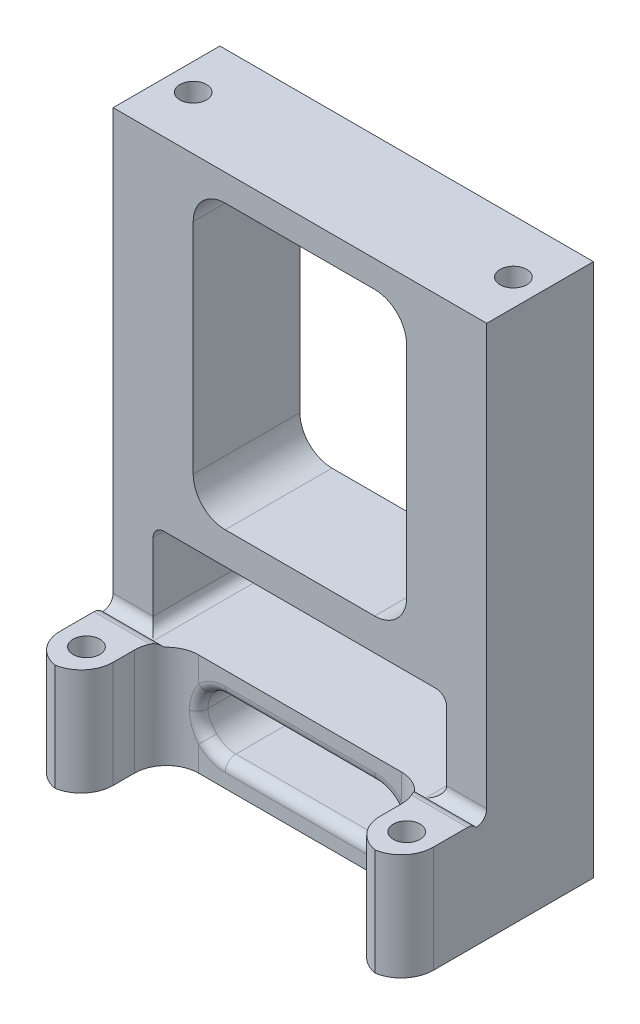
from build123d import *

# Parameters (mm, degrees)
SKETCH_1_W             = 35
SKETCH_1_H             = 50
SKETCH_1_W_2           = 16
SKETCH_1_H_2           = 8.4
EXTRUDE_564_DEPTH      = 5
SKETCH_2_W             = 5.75
SKETCH_2_H             = 8.4
CUT_EXTRUDE_879_DEPTH  = 8.5
FILLET_1_R             = 1
SKETCH_3_R             = 1.25
CUT_EXTRUDE_1403_DEPTH = 8
SKETCH_10_R            = 1.25
CUT_EXTRUDE_1593_DEPTH = 10
SKETCH_11_W            = 20
SKETCH_11_H            = 26.5
CUT_EXTRUDE_1977_DEPTH = 42.432957896
FILLET_2_R             = 3
SKETCH_13_W            = 5
SKETCH_13_H            = 8
EXTRUDE_4716_DEPTH     = 9.6
SKETCH_16_W            = 5
SKETCH_16_H            = 7
EXTRUDE_5207_DEPTH     = 0.4
SKETCH_14_R            = 1.25
CUT_EXTRUDE_5724_DEPTH = 46.55491192
FILLET_3_R             = 3
FILLET_4_R             = 1
FILLET_5_R             = 1
CUT_EXTRUDE_6952_REACH = 43.433
SKETCH_17_W            = 19
SKETCH_17_H            = 5
FILLET_6_R             = 2.5
FILLET_7_R             = 1


# Some blends are built 0.0001 mm under size
with BuildPart() as part:
    # Эскиз1 → Extrude 564 (new, symmetric)
    with BuildSketch(Plane.XY):
        with Locations((0, 11.2)):
            Rectangle(SKETCH_1_W, SKETCH_1_H)
        Rectangle(SKETCH_1_W_2, SKETCH_1_H_2, mode=Mode.SUBTRACT)
    extrude(amount=EXTRUDE_564_DEPTH, both=True)

    # Эскиз2 → Cut-Extrude 879 (cut)
    with BuildSketch(Plane.XY.offset(5)):
        with Locations((-10.875, 0)):
            Rectangle(SKETCH_2_W, SKETCH_2_H)
        with Locations((10.875, 0)):
            Rectangle(SKETCH_2_W, SKETCH_2_H)
    extrude(amount=-CUT_EXTRUDE_879_DEPTH, mode=Mode.SUBTRACT)

    # Скругление1
    fillet_1_edges = [part.edges().sort_by_distance(p)[0] for p in [
        (-13.75, -4.2, 0.75),
        (-13.75, 4.2, 0.75),
        (13.75, 4.2, 0.75),
        (13.75, -4.2, 0.75),
    ]]
    fillet(fillet_1_edges, radius=FILLET_1_R)

    # Эскиз3 → Cut-Extrude 1403 (cut)
    with BuildSketch(Plane.XY.offset(-3.5)):
        with Locations((-10.3, 0)):
            Circle(SKETCH_3_R)
        with Locations((10.3, 0)):
            Circle(SKETCH_3_R)
    extrude(amount=-CUT_EXTRUDE_1403_DEPTH, mode=Mode.SUBTRACT)

    # Эскиз10 → Cut-Extrude 1593 (cut)
    with BuildSketch(Plane.XZ.offset(13.8)):
        with Locations(Location((-15, 0, 0), (0, 0, 270))):
            Circle(SKETCH_10_R)
        with Locations(Location((15, 0, 0), (0, 0, 270))):
            Circle(SKETCH_10_R)
    cut_extrude_1593 = extrude(amount=-CUT_EXTRUDE_1593_DEPTH, mode=Mode.SUBTRACT)

    # Mirror 1655: Cut-Extrude 1593 across plane
    add(cut_extrude_1593.mirror(Plane.ZX.offset(11.2)), mode=Mode.SUBTRACT)

    # Эскиз11 → Cut-Extrude 1977 (cut, through all)
    with BuildSketch(Plane.XY.offset(5)):
        with Locations((0, 20.45)):
            Rectangle(SKETCH_11_W, SKETCH_11_H)
    extrude(amount=-CUT_EXTRUDE_1977_DEPTH, mode=Mode.SUBTRACT)

    # Скругление2
    fillet_2_edges = [part.edges().sort_by_distance(p)[0] for p in [
        (10, 7.2, 0),
        (-10, 7.2, 0),
        (-10, 33.7, 0),
        (10, 33.7, 0),
    ]]
    fillet(fillet_2_edges, radius=FILLET_2_R)

    # Эскиз13 → Extrude 4716 (add)
    with BuildSketch(Plane.XZ.offset(13.8)):
        with Locations((-15, 9)):
            Rectangle(SKETCH_13_W, SKETCH_13_H)
        with Locations((15, 9)):
            Rectangle(SKETCH_13_W, SKETCH_13_H)
    extrude(amount=-EXTRUDE_4716_DEPTH)

    # Эскиз16 → Extrude 5207 (add)
    with BuildSketch(Plane(origin=(0, -4.2, 0), x_dir=(1, 0, 0), z_dir=(0, 1, 0))):
        with Locations((-15, -9.5)):
            Rectangle(SKETCH_16_W, SKETCH_16_H)
        with Locations((15, -9.5)):
            Rectangle(SKETCH_16_W, SKETCH_16_H)
    extrude(amount=EXTRUDE_5207_DEPTH)

    # Эскиз14 → Cut-Extrude 5724 (cut, through all)
    with BuildSketch(Plane(origin=(0, -3.8, 0), x_dir=(1, 0, 0), z_dir=(0, 1, 0))):
        with Locations(Location((-15, -10, 0), (0, 0, 270))):
            Circle(SKETCH_14_R)
        with Locations(Location((15, -10, 0), (0, 0, 90))):
            Circle(SKETCH_14_R)
    extrude(amount=-CUT_EXTRUDE_5724_DEPTH, mode=Mode.SUBTRACT)

    # Скругление3
    # the kernel refuses this fillet: 3 mm, written as the material it adds along each edge
    with BuildSketch(Plane(origin=(12.5, -13.8, 5), x_dir=(-1, 0, 0), z_dir=(0, 1, 0))) as fillet_3_piece_1_section:
        with BuildLine():
            CenterArc((FILLET_3_R, FILLET_3_R), FILLET_3_R, 180, 90)
            Line((0, FILLET_3_R), (0, 0))
            Line((0, 0), (FILLET_3_R, 0))
        make_face()
    fillet_3_piece_1 = extrude(amount=9.6, mode=Mode.PRIVATE)
    fillet_3_piece_1 = split(fillet_3_piece_1, bisect_by=Plane(origin=(11.641402177, -9, 6), z_dir=(0, 0, -1)), keep=Keep.TOP, mode=Mode.PRIVATE)
    add(fillet_3_piece_1)
    with BuildSketch(Plane(origin=(12.5, -13.8, 5), x_dir=(-1, 0, 0), z_dir=(0, 1, 0))) as fillet_3_piece_2_section:
        with BuildLine():
            CenterArc((FILLET_3_R, FILLET_3_R), FILLET_3_R, 180, 90)
            Line((0, FILLET_3_R), (0, 0))
            Line((0, 0), (FILLET_3_R, 0))
        make_face()
    fillet_3_piece_2 = extrude(amount=9.6, mode=Mode.PRIVATE)
    fillet_3_piece_2 = split(fillet_3_piece_2, bisect_by=Plane(origin=(12.327479681, -9, 6), z_dir=(0, 0, 1)), keep=Keep.TOP, mode=Mode.PRIVATE)
    add(fillet_3_piece_2)
    with BuildSketch(Plane(origin=(12.5, -13.8, 5), x_dir=(-1, 0, 0), z_dir=(0, 1, 0))) as fillet_3_piece_3_section:
        with BuildLine():
            CenterArc((FILLET_3_R, FILLET_3_R), FILLET_3_R, 180, 90)
            Line((0, FILLET_3_R), (0, 0))
            Line((0, 0), (FILLET_3_R, 0))
        make_face()
    fillet_3_piece_3 = extrude(amount=17.1, mode=Mode.PRIVATE)
    fillet_3_piece_3 = split(fillet_3_piece_3, bisect_by=Plane(origin=(12.327479681, -4.2, 6.589070595), z_dir=(0, 1, 0)), keep=Keep.TOP, mode=Mode.PRIVATE)
    fillet_3_piece_3 = split(fillet_3_piece_3, bisect_by=Plane(origin=(12.327479681, -3.8, 6.589070595), z_dir=(0, -1, 0)), keep=Keep.TOP, mode=Mode.PRIVATE)
    fillet_3_piece_3 = split(fillet_3_piece_3, bisect_by=Plane(origin=(12.327479681, -4, 6), z_dir=(0, 0, 1)), keep=Keep.TOP, mode=Mode.PRIVATE)
    add(fillet_3_piece_3)
    with BuildSketch(Plane(origin=(-12.5, -13.8, 5), x_dir=(0, 0, 1), z_dir=(0, 1, 0))) as fillet_3_piece_4_section:
        with BuildLine():
            CenterArc((FILLET_3_R, FILLET_3_R), FILLET_3_R, 180, 90)
            Line((0, FILLET_3_R), (0, 0))
            Line((0, 0), (FILLET_3_R, 0))
        make_face()
    fillet_3_piece_4 = extrude(amount=9.6, mode=Mode.PRIVATE)
    fillet_3_piece_4 = split(fillet_3_piece_4, bisect_by=Plane(origin=(-12.327479681, -9, 6), z_dir=(0, 0, 1)), keep=Keep.TOP, mode=Mode.PRIVATE)
    add(fillet_3_piece_4)
    with BuildSketch(Plane(origin=(-12.5, -13.8, 5), x_dir=(0, 0, 1), z_dir=(0, 1, 0))) as fillet_3_piece_5_section:
        with BuildLine():
            CenterArc((FILLET_3_R, FILLET_3_R), FILLET_3_R, 180, 90)
            Line((0, FILLET_3_R), (0, 0))
            Line((0, 0), (FILLET_3_R, 0))
        make_face()
    fillet_3_piece_5 = extrude(amount=9.6, mode=Mode.PRIVATE)
    fillet_3_piece_5 = split(fillet_3_piece_5, bisect_by=Plane(origin=(-11.641402177, -9, 6), z_dir=(0, 0, -1)), keep=Keep.TOP, mode=Mode.PRIVATE)
    add(fillet_3_piece_5)
    with BuildSketch(Plane(origin=(-12.5, -13.8, 5), x_dir=(0, 0, 1), z_dir=(0, 1, 0))) as fillet_3_piece_6_section:
        with BuildLine():
            CenterArc((FILLET_3_R, FILLET_3_R), FILLET_3_R, 180, 90)
            Line((0, FILLET_3_R), (0, 0))
            Line((0, 0), (FILLET_3_R, 0))
        make_face()
    fillet_3_piece_6 = extrude(amount=17.1, mode=Mode.PRIVATE)
    fillet_3_piece_6 = split(fillet_3_piece_6, bisect_by=Plane(origin=(-12.327479681, -4.2, 6.589070595), z_dir=(0, 1, 0)), keep=Keep.TOP, mode=Mode.PRIVATE)
    fillet_3_piece_6 = split(fillet_3_piece_6, bisect_by=Plane(origin=(-12.327479681, -4, 6), z_dir=(0, 0, 1)), keep=Keep.TOP, mode=Mode.PRIVATE)
    fillet_3_piece_6 = split(fillet_3_piece_6, bisect_by=Plane(origin=(-12.327479681, -3.8, 6.589070595), z_dir=(0, -1, 0)), keep=Keep.TOP, mode=Mode.PRIVATE)
    add(fillet_3_piece_6)
    # the kernel refuses this fillet: 3 mm, written as the material it takes off along each edge
    with BuildSketch(Plane(origin=(17.5, 3.7, 13), x_dir=(-1, 0, 0), z_dir=(0, -1, 0)), Plane(origin=(12.5, -21.3, 13), x_dir=(1, 0, 0), z_dir=(0, 1, 0)), Plane(origin=(-17.5, -21.3, 13), x_dir=(1, 0, 0), z_dir=(0, 1, 0)), Plane(origin=(-12.5, -21.3, 13), x_dir=(0, 0, -1), z_dir=(0, 1, 0))) as fillet_3_2_piece_1:
        with BuildLine():
            CenterArc((FILLET_3_R, FILLET_3_R), FILLET_3_R, 180, 90)
            Line((0, FILLET_3_R), (0, 0))
            Line((0, 0), (FILLET_3_R, 0))
        make_face()
    extrude(amount=25, mode=Mode.SUBTRACT)

    # Скругление4
    fillet_4_edges = [part.edges().sort_by_distance(p)[0] for p in [
        (15.125, -4.2, 5),
        (-15.125, -4.2, 5),
    ]]
    fillet(fillet_4_edges, radius=FILLET_4_R - 0.0001)  # a hair under: the kernel refuses the full size

    # Скругление5
    # the kernel refuses this fillet: 1 mm, written as the material it takes off along each edge
    with BuildSketch(Plane(origin=(9.736067977, -3.8, 6), x_dir=(0, 0, 1), z_dir=(1, 0, 0))) as fillet_5_piece_1:
        with BuildLine():
            CenterArc((0.8, 1), FILLET_5_R, 216.869897646, 53.130102354)
            Line((0, 0.4), (-0.016, 0.388))
            ThreePointArc((-0.016, 0.388), (-0.02, 0.2), (-0.02, 0))
            Line((-0.02, 0), (0, -0.02))
            Line((0, -0.02), (0.8, -0.02))
            Line((0.8, -0.02), (0.8, 0))
        make_face()
    extrude(amount=9.763932023, mode=Mode.SUBTRACT)
    with BuildSketch(Plane(origin=(-9.736067977, -3.8, 6), x_dir=(0, -1, 0), z_dir=(-1, 0, 0))) as fillet_5_piece_2:
        with BuildLine():
            CenterArc((1, 0.8), FILLET_5_R, 180, 53.130102354)
            Line((0, 0.8), (-0.02, 0.8))
            Line((-0.02, 0.8), (-0.02, 0))
            Line((-0.02, 0), (0, -0.02))
            ThreePointArc((0, -0.02), (0.2, -0.02), (0.388, -0.016))
            Line((0.388, -0.016), (0.4, 0))
        make_face()
    extrude(amount=9.763932023, mode=Mode.SUBTRACT)

    # Эскиз17 → Cut-Extrude 6952 (cut, up to next)
    with BuildSketch(Plane.XY.offset(5), mode=Mode.PRIVATE) as cut_extrude_6952_sk1:
        with Locations((0, -9)):
            Rectangle(SKETCH_17_W, SKETCH_17_H)
    cut_extrude_6952_tool1 = extrude(cut_extrude_6952_sk1.sketch, amount=-CUT_EXTRUDE_6952_REACH, mode=Mode.PRIVATE) & part.part
    add(cut_extrude_6952_tool1.solids().sort_by_distance((0, -9, 5))[0], mode=Mode.SUBTRACT)

    # Скругление6
    fillet_6_edges = [part.edges().sort_by_distance(p)[0] for p in [
        (9.5, -6.5, 0),
        (9.5, -11.5, 0),
        (-9.5, -6.5, 0),
        (-9.5, -11.5, 0),
    ]]
    fillet(fillet_6_edges, radius=FILLET_6_R - 0.0001)  # a hair under: the kernel refuses the full size

    # Скругление7
    fillet_7_edges = [part.edges().sort_by_distance(p)[0] for p in [
        (0, -6.5, -5),
        (0, -6.5, 5),
        (0, -11.5, -5),
        (0, -11.5, 5),
        (8.767796242, -7.232203758, 5),
        (8.767796242, -7.232203758, -5),
        (8.767796242, -10.767796242, 5),
        (8.767796242, -10.767796242, -5),
        (-8.767796242, -7.232203758, 5),
        (-8.767796242, -7.232203758, -5),
        (-8.767796242, -10.767796242, 5),
        (-8.767796242, -10.767796242, -5),
    ]]
    fillet(fillet_7_edges, radius=FILLET_7_R)


solid = part.part
